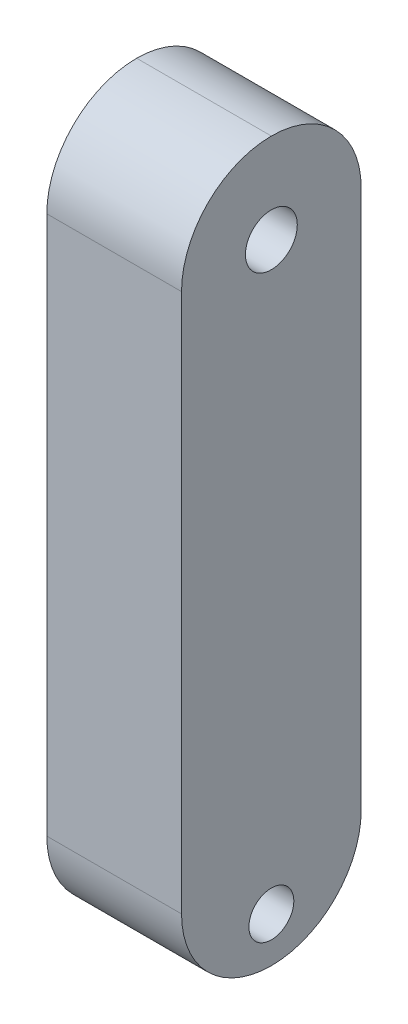
from build123d import *

# Parameters (mm, degrees)
SKETCH1_W           = 38.1
SKETCH1_H           = 50.8
BOSS_EXTRUDE1_DEPTH = 101.6
SKETCH2_R           = 6.35
CUT_EXTRUDE1_DEPTH  = 112.44204772
FILLET1_R           = 25.4
SKETCH3_R           = 7.332348419
CUT_EXTRUDE2_DEPTH  = 441.771925846


with BuildPart() as part:
    # Sketch1 → Boss-Extrude1 (new, symmetric)
    with BuildSketch(Plane(origin=(0, 0, 0), x_dir=(1, 0, 0), z_dir=(0, 1, 0))):
        Rectangle(SKETCH1_W, SKETCH1_H)
    extrude(amount=BOSS_EXTRUDE1_DEPTH, both=True)

    # Sketch2 → Cut-Extrude1 (cut, through all)
    with BuildSketch(Plane(origin=(19.05, 0, 0), x_dir=(0, 0, -1), z_dir=(1, 0, 0))):
        with Locations((0, -88.9)):
            Circle(SKETCH2_R)
    extrude(amount=-CUT_EXTRUDE1_DEPTH, mode=Mode.SUBTRACT)

    # Fillet1
    fillet1_edges = [part.edges().sort_by_distance(p)[0] for p in [
        (0, -101.6, -25.4),
        (0, -101.6, 25.4),
        (0, 101.6, 25.4),
        (0, 101.6, -25.4),
    ]]
    fillet(fillet1_edges, radius=FILLET1_R - 0.0001)  # a hair under: the kernel refuses the full size

    # Sketch3 → Cut-Extrude2 (cut, through all)
    with BuildSketch(Plane(origin=(292.1, -73.474884434, -233.084724799), x_dir=(0, 0.5719099585576003, -0.8203164019466171), z_dir=(1, 0, 0))):
        with Locations(Location((-105.602665842, 256.084237961, 0), (0, 0, 325.116479352))):
            Circle(SKETCH3_R)
    extrude(amount=-CUT_EXTRUDE2_DEPTH, mode=Mode.SUBTRACT)


solid = part.part
